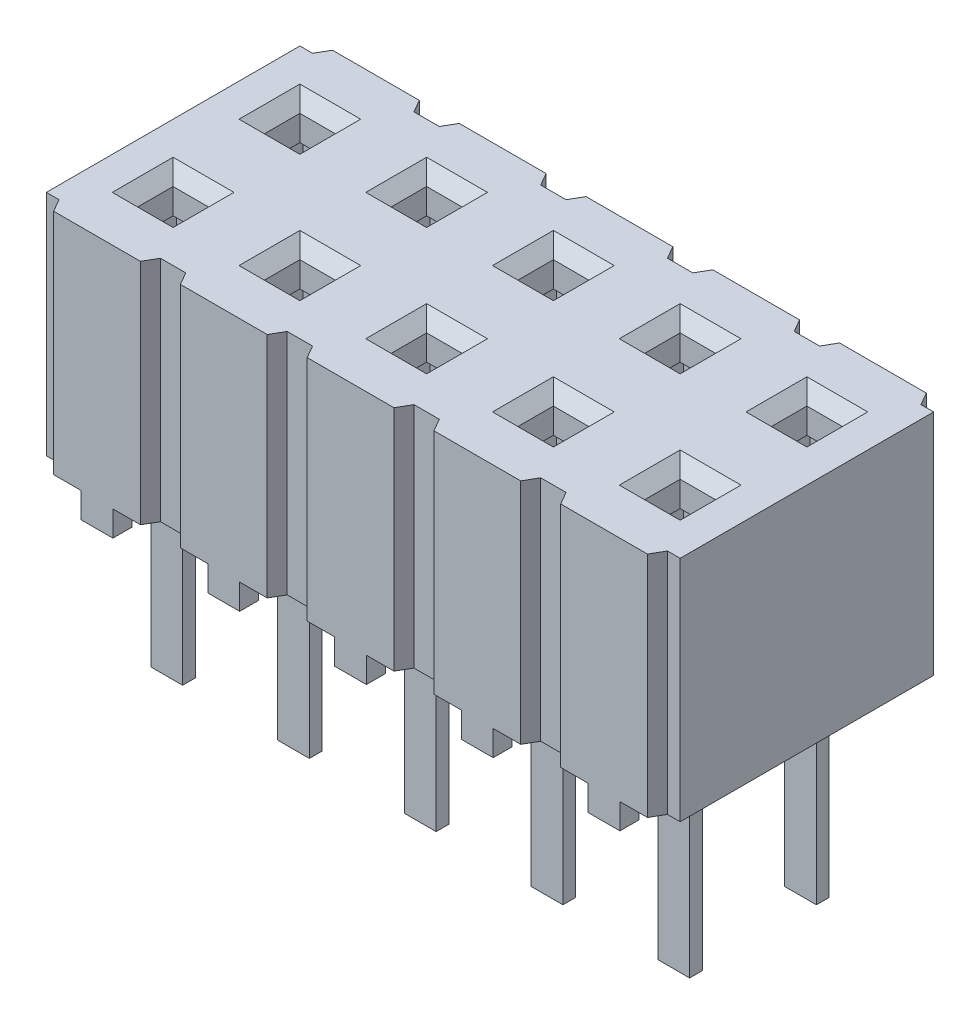
from build123d import *

# Parameters (mm, degrees)
SKETCH1_W                    = 12.7
SKETCH1_H                    = 5.588
BASE_EXTRUDE_DEPTH           = 5.08
SKETCH2_W                    = 4.826
SKETCH2_H                    = 0.508
STANDOFF_LENGTH_DEPTH        = 14.960760581
SKETCH3_W                    = 0.9525
SKETCH3_H                    = 0.508
STANDOFF_WIDTH_DEPTH         = 10.866845697
SKETCH4_W                    = 0.7112
SKETCH4_H                    = 0.7112
OPENING_DEPTH                = 0.762
LEAD_IN_SIZE                 = 0.254
SKETCH5_W                    = 1.778
SKETCH5_H                    = 1.905
CORE_DEPTH                   = 9.171539635
SNAP_GROOVE_DEPTH            = 9.598565927
CONTACT_TAIL_DEPTH           = 0.3175
SKETCH8_W                    = 0.4572
SKETCH8_H                    = 1.8796
CONTACT_BOTTOM_DEPTH         = 0.254
CORE_PATTERN_COUNT           = 5
CORE_PATTERN_PITCH           = 2.54
LEAD_IN_OF_CORE_PATTERN_SIZE = 0.254
STANDOFF_PATTERN_COUNT       = 5
STANDOFF_PATTERN_PITCH       = 2.54
PIN_PATTERN_COUNT            = 5
PIN_PATTERN_PITCH            = 2.54
D_START                      = -2.2225
D_CORE_MIRROR_OUTLINE_W      = 1.778
D_CORE_MIRROR_OUTLINE_H      = 3.81
D_CORE_MIRROR_DEPTH          = 1.905
D_START_2                    = -1.8796
D_CORE_MIRROR_2_DEPTH        = 1.2192
D_START_3                    = -5.969
D_CORE_MIRROR_3_DEPTH        = 11.938
D_PIN_MIRROR_COPY_1_DEPTH    = 0.3175
D_PIN_MIRROR_COPY_2_DEPTH    = 0.3175
D_PIN_MIRROR_COPY_3_DEPTH    = 0.3175
D_PIN_MIRROR_COPY_4_DEPTH    = 0.3175
D_PIN_MIRROR_COPY_5_SKETCH_W = 0.4572
D_PIN_MIRROR_COPY_5_SKETCH_H = 1.8796
D_PIN_MIRROR_COPY_5_DEPTH    = 0.254
D_PIN_MIRROR_COPY_6_SKETCH_W = 0.4572
D_PIN_MIRROR_COPY_6_SKETCH_H = 1.8796
D_PIN_MIRROR_COPY_6_DEPTH    = 0.254
D_PIN_MIRROR_COPY_7_SKETCH_W = 0.4572
D_PIN_MIRROR_COPY_7_SKETCH_H = 1.8796
D_PIN_MIRROR_COPY_7_DEPTH    = 0.254
D_PIN_MIRROR_COPY_8_SKETCH_W = 0.4572
D_PIN_MIRROR_COPY_8_SKETCH_H = 1.8796
D_PIN_MIRROR_COPY_8_DEPTH    = 0.254


with BuildPart() as part:
    # Sketch1 → Base-Extrude (new body)
    with BuildSketch(Plane(origin=(0, 0, 0), x_dir=(1, 0, 0), z_dir=(0, 1, 0))):
        Rectangle(SKETCH1_W, SKETCH1_H)
    extrude(amount=-BASE_EXTRUDE_DEPTH)

    # Sketch2 → Standoff- length (cut, through all)
    with BuildSketch(Plane.ZY.offset(6.35)):
        with Locations((0, -4.826)):
            Rectangle(SKETCH2_W, SKETCH2_H)
    extrude(amount=-STANDOFF_LENGTH_DEPTH, mode=Mode.SUBTRACT)

    # Sketch3 → Standoff- width (cut, through all)
    with BuildSketch(Plane.XY.offset(2.794)):
        with Locations((-5.87375, -4.826)):
            Rectangle(SKETCH3_W, SKETCH3_H)
        with Locations((-4.28625, -4.826)):
            Rectangle(SKETCH3_W, SKETCH3_H)
    standoff_width = extrude(amount=-STANDOFF_WIDTH_DEPTH, mode=Mode.SUBTRACT)

    # Sketch4 → Opening (cut)
    with BuildSketch(Plane(origin=(0, 0, 0), x_dir=(-1, 0, 0), z_dir=(0, 1, 0))):
        with Locations((5.08, 1.27)):
            Rectangle(SKETCH4_W, SKETCH4_H)
    opening = extrude(amount=-OPENING_DEPTH, mode=Mode.SUBTRACT)

    # Lead-in
    lead_in_edges = [part.edges().sort_by_distance(p)[0] for p in [
        (-5.4356, 0, 1.27),
        (-5.08, 0, 1.6256),
        (-4.7244, 0, 1.27),
        (-5.08, 0, 0.9144),
    ]]
    chamfer(lead_in_edges, length=LEAD_IN_SIZE)

    # Sketch5 → Core (cut, through all)
    with BuildSketch(Plane(origin=(0, -0.762, 0), x_dir=(-1, 0, 0), z_dir=(0, 1, 0))):
        with Locations((5.08, 1.27)):
            Rectangle(SKETCH5_W, SKETCH5_H)
    core = extrude(amount=-CORE_DEPTH, mode=Mode.SUBTRACT)

    # Sketch6 → Snap Groove (cut, through all)
    with BuildSketch(Plane(origin=(0, 0, 0), x_dir=(-1, 0, 0), z_dir=(0, 1, 0))):
        Polygon((6.35, 2.794), (6.35, 2.54), (6.096, 2.54), (5.949353032, 2.794), align=None)
        Polygon((5.949353032, -2.794), (6.35, -2.794), (6.35, -2.54), (6.096, -2.54), align=None)
        Polygon((3.81, -2.794), (3.81, -2.54), (4.064, -2.54), (4.210646968, -2.794), align=None)
        Polygon((4.210646968, 2.794), (3.81, 2.794), (3.81, 2.54), (4.064, 2.54), align=None)
    snap_groove = extrude(amount=-SNAP_GROOVE_DEPTH, mode=Mode.SUBTRACT)

    # Sketch7 → Contact Tail (add, symmetric)
    with BuildSketch(Plane.ZY.offset(5.08)):
        with BuildLine():
            Line((0.3302, -4.572), (0.3302, -4.318))
            Line((0.3302, -4.318), (2.2225, -4.318))
            Line((2.2225, -4.318), (2.2225, -4.572))
            ThreePointArc((2.2225, -4.572), (2.177798553, -4.734441372), (2.056281421, -4.851141866))
            Line((2.056281421, -4.851141866), (1.563218579, -5.118358134))
            ThreePointArc((1.563218579, -5.118358134), (1.441701447, -5.235058628), (1.397, -5.3975))
            Line((1.397, -5.3975), (1.397, -8.3312))
            Line((1.397, -8.3312), (1.143, -8.3312))
            Line((1.143, -8.3312), (1.143, -5.3975))
            ThreePointArc((1.143, -5.3975), (1.223462604, -5.10510553), (1.442193442, -4.89504464))
            Line((1.442193442, -4.89504464), (1.935256284, -4.627828373))
            ThreePointArc((1.935256284, -4.627828373), (1.959559711, -4.604488274), (1.9685, -4.572))
            Line((1.9685, -4.572), (0.3302, -4.572))
        make_face()
    contact_tail = extrude(amount=CONTACT_TAIL_DEPTH, both=True)

    # Sketch8 → Contact Bottom (add)
    with BuildSketch(Plane.XZ.offset(4.572)):
        with Locations((-4.5339, 1.27)):
            Rectangle(SKETCH8_W, SKETCH8_H)
        with Locations((-5.6261, 1.27)):
            Rectangle(SKETCH8_W, SKETCH8_H)
    contact_bottom = extrude(amount=-CONTACT_BOTTOM_DEPTH)

    # Core Pattern: Opening, Core ×5
    with Locations(*[(i * CORE_PATTERN_PITCH, 0, 0) for i in range(1, CORE_PATTERN_COUNT)]):
        add(opening, mode=Mode.SUBTRACT)
        add(core, mode=Mode.SUBTRACT)

    # Lead-in of Core Pattern
    lead_in_of_core_pattern_edges = [part.edges().sort_by_distance(p)[0] for p in [
        (-2.8956, 0, 1.27),
        (-2.54, 0, 1.6256),
        (-2.1844, 0, 1.27),
        (-2.54, 0, 0.9144),
        (-0.3556, 0, 1.27),
        (0, 0, 1.6256),
        (0.3556, 0, 1.27),
        (0, 0, 0.9144),
        (2.1844, 0, 1.27),
        (2.54, 0, 1.6256),
        (2.8956, 0, 1.27),
        (2.54, 0, 0.9144),
        (4.7244, 0, 1.27),
        (5.08, 0, 1.6256),
        (5.4356, 0, 1.27),
        (5.08, 0, 0.9144),
    ]]
    chamfer(lead_in_of_core_pattern_edges, length=LEAD_IN_OF_CORE_PATTERN_SIZE)

    # Standoff Pattern: Standoff- width, Snap Groove ×5
    with Locations(*[(i * STANDOFF_PATTERN_PITCH, 0, 0) for i in range(1, STANDOFF_PATTERN_COUNT)]):
        add(standoff_width, mode=Mode.SUBTRACT)
        add(snap_groove, mode=Mode.SUBTRACT)

    # Pin Pattern: Contact Tail, Contact Bottom ×5
    with Locations(*[(i * PIN_PATTERN_PITCH, 0, 0) for i in range(1, PIN_PATTERN_COUNT)]):
        add(contact_tail)
        add(contact_bottom)

    # -D Core Mirror: read off the stored shape, not the designer's step
    # -D Core Mirror outline → -D Core Mirror (cut)
    with BuildSketch(Plane.XY.offset(D_START)):
        with Locations((-5.08, -2.667)):
            Rectangle(D_CORE_MIRROR_OUTLINE_W, D_CORE_MIRROR_OUTLINE_H)
        with Locations((-2.54, -2.667)):
            Rectangle(D_CORE_MIRROR_OUTLINE_W, D_CORE_MIRROR_OUTLINE_H)
        with Locations((0, -2.667)):
            Rectangle(D_CORE_MIRROR_OUTLINE_W, D_CORE_MIRROR_OUTLINE_H)
        with Locations((2.54, -2.667)):
            Rectangle(D_CORE_MIRROR_OUTLINE_W, D_CORE_MIRROR_OUTLINE_H)
        with Locations((5.08, -2.667)):
            Rectangle(D_CORE_MIRROR_OUTLINE_W, D_CORE_MIRROR_OUTLINE_H)
    extrude(amount=D_CORE_MIRROR_DEPTH, mode=Mode.SUBTRACT)

    # D Core Mirror 2 outline → D Core Mirror 2 (cut)
    with BuildSketch(Plane.XY.offset(D_START_2)):
        Polygon((-5.4356, -0.254), (-5.4356, -0.762), (-4.7244, -0.762), (-4.7244, -0.254), (-4.4704, 0), (-5.6896, 0), align=None)
        Polygon((-1.9304, 0), (-3.1496, 0), (-2.8956, -0.254), (-2.8956, -0.762), (-2.1844, -0.762), (-2.1844, -0.254), align=None)
        Polygon((0.6096, 0), (-0.6096, 0), (-0.3556, -0.254), (-0.3556, -0.762), (0.3556, -0.762), (0.3556, -0.254), align=None)
        Polygon((3.1496, 0), (1.9304, 0), (2.1844, -0.254), (2.1844, -0.762), (2.8956, -0.762), (2.8956, -0.254), align=None)
        Polygon((5.6896, 0), (4.4704, 0), (4.7244, -0.254), (4.7244, -0.762), (5.4356, -0.762), (5.4356, -0.254), align=None)
    extrude(amount=D_CORE_MIRROR_2_DEPTH, mode=Mode.SUBTRACT)

    # D Core Mirror 3 outline → D Core Mirror 3 (add)
    with BuildSketch(Plane.YZ.offset(D_START_3)):
        Polygon((0, -0.6604), (-0.762, -0.6604), (-0.762, -0.9144), (-0.254, -0.9144), align=None)
        Polygon((-0.254, -1.6256), (-0.762, -1.6256), (-0.762, -1.8796), (0, -1.8796), align=None)
    extrude(amount=D_CORE_MIRROR_3_DEPTH)

    # -D Pin Mirror: Contact Tail, Contact Bottom across plane
    add(contact_tail.mirror(Plane.XY))
    add(contact_bottom.mirror(Plane.XY))

    # -D Pin Mirror copy 1 sketch → -D Pin Mirror copy 1 (add, symmetric)
    with BuildSketch(Plane(origin=(-2.54, 0, 0), x_dir=(0, 0, -1), z_dir=(-1, 0, 0))):
        with BuildLine():
            Line((0.3302, 4.572), (0.3302, 4.318))
            Line((0.3302, 4.318), (2.2225, 4.318))
            Line((2.2225, 4.318), (2.2225, 4.572))
            ThreePointArc((2.2225, 4.572), (2.177798553, 4.734441372), (2.056281421, 4.851141866))
            Line((2.056281421, 4.851141866), (1.563218579, 5.118358134))
            ThreePointArc((1.563218579, 5.118358134), (1.441701447, 5.235058628), (1.397, 5.3975))
            Line((1.397, 5.3975), (1.397, 8.3312))
            Line((1.397, 8.3312), (1.143, 8.3312))
            Line((1.143, 8.3312), (1.143, 5.3975))
            ThreePointArc((1.143, 5.3975), (1.223462604, 5.10510553), (1.442193442, 4.89504464))
            Line((1.442193442, 4.89504464), (1.935256284, 4.627828373))
            ThreePointArc((1.935256284, 4.627828373), (1.959559711, 4.604488274), (1.9685, 4.572))
            Line((1.9685, 4.572), (0.3302, 4.572))
        make_face()
    extrude(amount=D_PIN_MIRROR_COPY_1_DEPTH, both=True)

    # -D Pin Mirror copy 2 sketch → -D Pin Mirror copy 2 (add, symmetric)
    with BuildSketch(Plane(origin=(0, 0, 0), x_dir=(0, 0, -1), z_dir=(-1, 0, 0))):
        with BuildLine():
            Line((0.3302, 4.572), (0.3302, 4.318))
            Line((0.3302, 4.318), (2.2225, 4.318))
            Line((2.2225, 4.318), (2.2225, 4.572))
            ThreePointArc((2.2225, 4.572), (2.177798553, 4.734441372), (2.056281421, 4.851141866))
            Line((2.056281421, 4.851141866), (1.563218579, 5.118358134))
            ThreePointArc((1.563218579, 5.118358134), (1.441701447, 5.235058628), (1.397, 5.3975))
            Line((1.397, 5.3975), (1.397, 8.3312))
            Line((1.397, 8.3312), (1.143, 8.3312))
            Line((1.143, 8.3312), (1.143, 5.3975))
            ThreePointArc((1.143, 5.3975), (1.223462604, 5.10510553), (1.442193442, 4.89504464))
            Line((1.442193442, 4.89504464), (1.935256284, 4.627828373))
            ThreePointArc((1.935256284, 4.627828373), (1.959559711, 4.604488274), (1.9685, 4.572))
            Line((1.9685, 4.572), (0.3302, 4.572))
        make_face()
    extrude(amount=D_PIN_MIRROR_COPY_2_DEPTH, both=True)

    # -D Pin Mirror copy 3 sketch → -D Pin Mirror copy 3 (add, symmetric)
    with BuildSketch(Plane(origin=(2.54, 0, 0), x_dir=(0, 0, -1), z_dir=(-1, 0, 0))):
        with BuildLine():
            Line((0.3302, 4.572), (0.3302, 4.318))
            Line((0.3302, 4.318), (2.2225, 4.318))
            Line((2.2225, 4.318), (2.2225, 4.572))
            ThreePointArc((2.2225, 4.572), (2.177798553, 4.734441372), (2.056281421, 4.851141866))
            Line((2.056281421, 4.851141866), (1.563218579, 5.118358134))
            ThreePointArc((1.563218579, 5.118358134), (1.441701447, 5.235058628), (1.397, 5.3975))
            Line((1.397, 5.3975), (1.397, 8.3312))
            Line((1.397, 8.3312), (1.143, 8.3312))
            Line((1.143, 8.3312), (1.143, 5.3975))
            ThreePointArc((1.143, 5.3975), (1.223462604, 5.10510553), (1.442193442, 4.89504464))
            Line((1.442193442, 4.89504464), (1.935256284, 4.627828373))
            ThreePointArc((1.935256284, 4.627828373), (1.959559711, 4.604488274), (1.9685, 4.572))
            Line((1.9685, 4.572), (0.3302, 4.572))
        make_face()
    extrude(amount=D_PIN_MIRROR_COPY_3_DEPTH, both=True)

    # -D Pin Mirror copy 4 sketch → -D Pin Mirror copy 4 (add, symmetric)
    with BuildSketch(Plane(origin=(5.08, 0, 0), x_dir=(0, 0, -1), z_dir=(-1, 0, 0))):
        with BuildLine():
            Line((0.3302, 4.572), (0.3302, 4.318))
            Line((0.3302, 4.318), (2.2225, 4.318))
            Line((2.2225, 4.318), (2.2225, 4.572))
            ThreePointArc((2.2225, 4.572), (2.177798553, 4.734441372), (2.056281421, 4.851141866))
            Line((2.056281421, 4.851141866), (1.563218579, 5.118358134))
            ThreePointArc((1.563218579, 5.118358134), (1.441701447, 5.235058628), (1.397, 5.3975))
            Line((1.397, 5.3975), (1.397, 8.3312))
            Line((1.397, 8.3312), (1.143, 8.3312))
            Line((1.143, 8.3312), (1.143, 5.3975))
            ThreePointArc((1.143, 5.3975), (1.223462604, 5.10510553), (1.442193442, 4.89504464))
            Line((1.442193442, 4.89504464), (1.935256284, 4.627828373))
            ThreePointArc((1.935256284, 4.627828373), (1.959559711, 4.604488274), (1.9685, 4.572))
            Line((1.9685, 4.572), (0.3302, 4.572))
        make_face()
    extrude(amount=D_PIN_MIRROR_COPY_4_DEPTH, both=True)

    # -D Pin Mirror copy 5 sketch → -D Pin Mirror copy 5 (add)
    with BuildSketch(Plane(origin=(2.54, -4.572, 0), x_dir=(1, 0, 0), z_dir=(0, -1, 0))):
        with Locations((-4.5339, -1.27)):
            Rectangle(D_PIN_MIRROR_COPY_5_SKETCH_W, D_PIN_MIRROR_COPY_5_SKETCH_H)
        with Locations((-5.6261, -1.27)):
            Rectangle(D_PIN_MIRROR_COPY_5_SKETCH_W, D_PIN_MIRROR_COPY_5_SKETCH_H)
    extrude(amount=-D_PIN_MIRROR_COPY_5_DEPTH)

    # -D Pin Mirror copy 6 sketch → -D Pin Mirror copy 6 (add)
    with BuildSketch(Plane(origin=(5.08, -4.572, 0), x_dir=(1, 0, 0), z_dir=(0, -1, 0))):
        with Locations((-4.5339, -1.27)):
            Rectangle(D_PIN_MIRROR_COPY_6_SKETCH_W, D_PIN_MIRROR_COPY_6_SKETCH_H)
        with Locations((-5.6261, -1.27)):
            Rectangle(D_PIN_MIRROR_COPY_6_SKETCH_W, D_PIN_MIRROR_COPY_6_SKETCH_H)
    extrude(amount=-D_PIN_MIRROR_COPY_6_DEPTH)

    # -D Pin Mirror copy 7 sketch → -D Pin Mirror copy 7 (add)
    with BuildSketch(Plane(origin=(7.62, -4.572, 0), x_dir=(1, 0, 0), z_dir=(0, -1, 0))):
        with Locations((-4.5339, -1.27)):
            Rectangle(D_PIN_MIRROR_COPY_7_SKETCH_W, D_PIN_MIRROR_COPY_7_SKETCH_H)
        with Locations((-5.6261, -1.27)):
            Rectangle(D_PIN_MIRROR_COPY_7_SKETCH_W, D_PIN_MIRROR_COPY_7_SKETCH_H)
    extrude(amount=-D_PIN_MIRROR_COPY_7_DEPTH)

    # -D Pin Mirror copy 8 sketch → -D Pin Mirror copy 8 (add)
    with BuildSketch(Plane(origin=(10.16, -4.572, 0), x_dir=(1, 0, 0), z_dir=(0, -1, 0))):
        with Locations((-4.5339, -1.27)):
            Rectangle(D_PIN_MIRROR_COPY_8_SKETCH_W, D_PIN_MIRROR_COPY_8_SKETCH_H)
        with Locations((-5.6261, -1.27)):
            Rectangle(D_PIN_MIRROR_COPY_8_SKETCH_W, D_PIN_MIRROR_COPY_8_SKETCH_H)
    extrude(amount=-D_PIN_MIRROR_COPY_8_DEPTH)


solid = part.part
